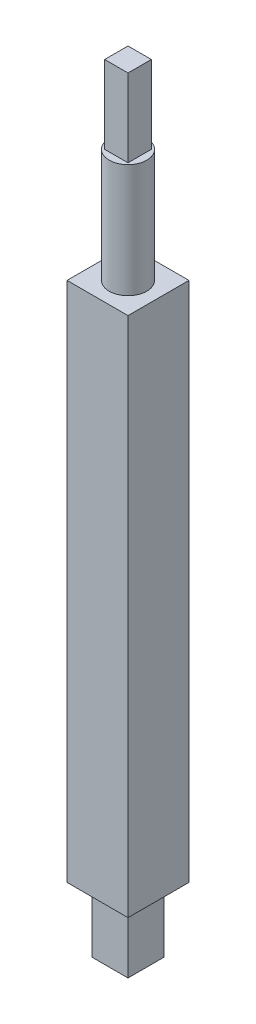
from build123d import *

# Parameters (mm, degrees)
SKETCH1_W           = 11.938
SKETCH1_H           = 11.938
BOSS_EXTRUDE1_DEPTH = 213.106
SKETCH2_R           = 3.68046
BOSS_EXTRUDE2_DEPTH = 22.225
BOSS_EXTRUDE3_START = 28.575
SKETCH3_R           = 3.68046
BOSS_EXTRUDE3_DEPTH = 28.575
SKETCH4_W           = 4.572
SKETCH4_H           = 4.572
BOSS_EXTRUDE4_DEPTH = 15.24
SKETCH5_R           = 9.137508411
CUT_EXTRUDE1_DEPTH  = 139.573
SKETCH6_W           = 7.0104
SKETCH6_H           = 7.0104
BOSS_EXTRUDE5_DEPTH = 12.7


with BuildPart() as part:
    # Sketch1 → Boss-Extrude1 (new body)
    with BuildSketch(Plane(origin=(0, 0, 0), x_dir=(1, 0, 0), z_dir=(0, 1, 0))):
        Rectangle(SKETCH1_W, SKETCH1_H)
    extrude(amount=BOSS_EXTRUDE1_DEPTH)

    # Sketch2 → Boss-Extrude2 (add)
    with BuildSketch(Plane(origin=(0, 213.106, 0), x_dir=(1, 0, 0), z_dir=(0, 1, 0))):
        Circle(SKETCH2_R)
    extrude(amount=BOSS_EXTRUDE2_DEPTH)

    # Sketch3 → Boss-Extrude3 (add)
    with BuildSketch(Plane(origin=(0, 0, 0), x_dir=(-1, 0, 0), z_dir=(0, -1, 0)).offset(BOSS_EXTRUDE3_START)):
        Circle(SKETCH3_R)
    extrude(amount=-BOSS_EXTRUDE3_DEPTH)

    # Sketch4 → Boss-Extrude4 (add)
    with BuildSketch(Plane(origin=(0, 235.331, 0), x_dir=(1, 0, 0), z_dir=(0, 1, 0))):
        Rectangle(SKETCH4_W, SKETCH4_H)
    extrude(amount=BOSS_EXTRUDE4_DEPTH)

    # Sketch5 → Cut-Extrude1 (cut)
    with BuildSketch(Plane(origin=(0, -28.575, 0), x_dir=(-1, 0, 0), z_dir=(0, -1, 0))):
        Circle(SKETCH5_R)
    extrude(amount=-CUT_EXTRUDE1_DEPTH, mode=Mode.SUBTRACT)

    # Sketch6 → Boss-Extrude5 (add)
    with BuildSketch(Plane(origin=(0, 110.998, 0), x_dir=(-1, 0, 0), z_dir=(0, -1, 0))):
        Rectangle(SKETCH6_W, SKETCH6_H)
    extrude(amount=BOSS_EXTRUDE5_DEPTH)


solid = part.part
